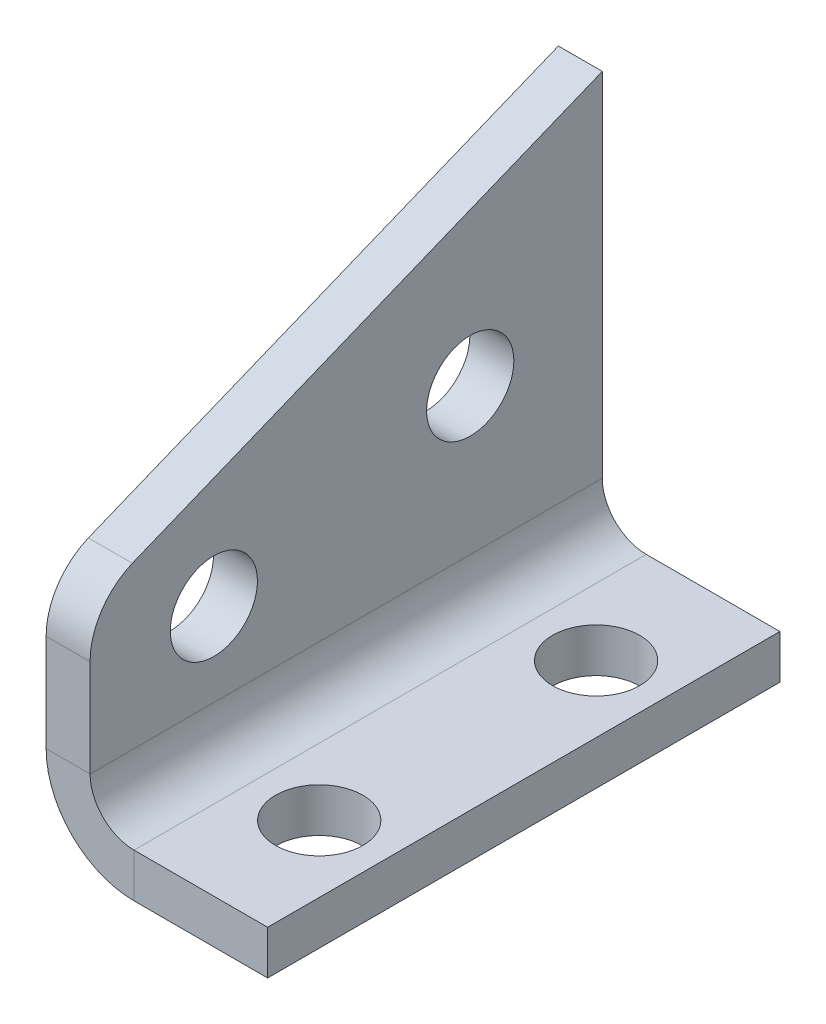
from build123d import *

# Parameters (mm, degrees)
SKETCH2_R                    = 3.15
BASE_FLANGE1_DEPTH           = 3.175
EDGE_FLANGE1_STRIP_W         = 19.05
EDGE_FLANGE1_STRIP_H         = 3.175
EDGE_FLANGE1_STRIP_CUT_DEPTH = 37
EDGE_FLANGE1_DEPTH           = 37
SKETCH10_R                   = 3.15
CUT_EXTRUDE1_DEPTH           = 10


# Sheet-metal steps are written as plain solids
with BuildPart() as part:
    # Sketch2 → Base-Flange1 (new body)
    with BuildSketch(Plane(origin=(0, 0, 0), x_dir=(0, 0, -1), z_dir=(1, 0, 0))):
        with BuildLine():
            Line((48.551064785, 40.291218586), (48.551064785, 72.093066751))
            Line((48.551064785, 72.093066751), (14.602650648, 58.297559694))
            ThreePointArc((14.602650648, 58.297559694), (12.37556545, 56.443388888), (11.551064785, 53.665249851))
            Line((11.551064785, 53.665249851), (11.551064785, 40.291218586))
            Line((11.551064785, 40.291218586), (48.551064785, 40.291218586))
        make_face()
        with Locations((39.011220588, 57.194773579)):
            Circle(SKETCH2_R, mode=Mode.SUBTRACT)
        with Locations((20.490203266, 52.672523101)):
            Circle(SKETCH2_R, mode=Mode.SUBTRACT)
    extrude(amount=-BASE_FLANGE1_DEPTH)

    # Edge-Flange1 strip (across the edge) → Edge-Flange1 strip cut (cut)
    with BuildSketch(Plane(origin=(0, 40.291218586, -11.551064785), x_dir=(0, 1, 0), z_dir=(0, 0, -1))):
        with Locations((-3.175, -1.5875)):
            Rectangle(EDGE_FLANGE1_STRIP_W, EDGE_FLANGE1_STRIP_H)
    extrude(amount=EDGE_FLANGE1_STRIP_CUT_DEPTH, mode=Mode.SUBTRACT)

    # Edge-Flange1 section (across the edge) → Edge-Flange1 (add)
    with BuildSketch(Plane(origin=(0, 40.291218586, -11.551064785), x_dir=(0, 1, 0), z_dir=(0, 0, -1))):
        with BuildLine():
            Line((0, 3.175), (0, 12.825))
            Line((0, 12.825), (3.175, 12.825))
            Line((3.175, 12.825), (3.175, 3.175))
            ThreePointArc((3.175, 3.175), (4.10493597, 0.92993597), (6.35, 0))
            Line((6.35, 0), (6.35, -3.175))
            ThreePointArc((6.35, -3.175), (1.859871939, -1.315128061), (0, 3.175))
        make_face()
    extrude(amount=EDGE_FLANGE1_DEPTH)

    # Sketch10 → Cut-Extrude1 (cut)
    with BuildSketch(Plane(origin=(0, 43.466218586, 0), x_dir=(1, 0, 0), z_dir=(0, 1, 0))):
        with Locations(Location((8, 40.102300831, 0), (0, 0, 180))):
            Circle(SKETCH10_R)
        with Locations(Location((8, 20.102300831, 0), (0, 0, 180))):
            Circle(SKETCH10_R)
    extrude(amount=-CUT_EXTRUDE1_DEPTH, mode=Mode.SUBTRACT)


solid = part.part
